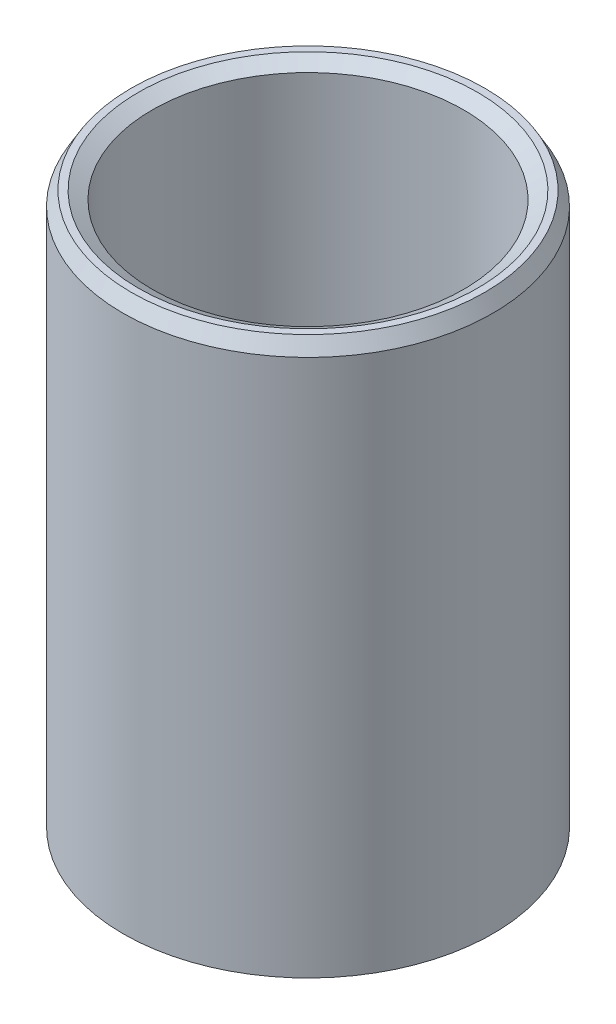
from build123d import *
from OCP.BRepFilletAPI import BRepFilletAPI_MakeChamfer

# Parameters (mm, degrees)
SKETCH1_R           = 22.5
BOSS_EXTRUDE1_DEPTH = 68.083866794
SKETCH2_R           = 18.933896838
CUT_EXTRUDE1_DEPTH  = 76.152597544
CHAMFER1_SIZE       = 1.708524689
CHAMFER1_SIZE2      = 0.986417189


with BuildPart() as part:
    # Sketch1 → Boss-Extrude1 (new body)
    with BuildSketch(Plane(origin=(0, 0, 0), x_dir=(1, 0, 0), z_dir=(0, 1, 0))):
        Circle(SKETCH1_R)
    extrude(amount=BOSS_EXTRUDE1_DEPTH)

    # Sketch2 → Cut-Extrude1 (cut, through all)
    with BuildSketch(Plane(origin=(0, 0, 0), x_dir=(1, 0, 0), z_dir=(0, 1, 0))):
        Circle(SKETCH2_R)
    extrude(amount=CUT_EXTRUDE1_DEPTH, mode=Mode.SUBTRACT)

    # Chamfer1: one chamfer whose edges measure the first distance from different faces: ONE call of the kernel's chamfer builder (chamfer() names one face for all edges)
    chamfer1_edges_1 = [part.edges().sort_by_distance(p)[0] for p in [
        (-18.933896838, 68.083866794, 0),
    ]]
    chamfer1_side_1 = [part.faces().sort_by_distance(p)[0] for p in [
        (-21.863603897, 68.083866794, 0),
    ]]
    chamfer1_edges_2 = [part.edges().sort_by_distance(p)[0] for p in [
        (-18.933896838, 0, 0),
    ]]
    chamfer1_side_2 = [part.faces().sort_by_distance(p)[0] for p in [
        (-18.933896838, 34.041933397, 0),
    ]]
    chamfer1_edges_3 = [part.edges().sort_by_distance(p)[0] for p in [
        (-22.5, 0, 0),
    ]]
    chamfer1_side_3 = [part.faces().sort_by_distance(p)[0] for p in [
        (-21.863603897, 0, 0),
    ]]
    chamfer1_edges_4 = [part.edges().sort_by_distance(p)[0] for p in [
        (-22.5, 68.083866794, 0),
    ]]
    chamfer1_side_4 = [part.faces().sort_by_distance(p)[0] for p in [
        (-22.5, 34.041933397, 0),
    ]]
    chamfer1 = BRepFilletAPI_MakeChamfer(part.part.solid().wrapped)
    for e in chamfer1_edges_1:
        chamfer1.Add(CHAMFER1_SIZE, CHAMFER1_SIZE2, e.wrapped, chamfer1_side_1[0].wrapped)  # the first distance lies on this face
    for e in chamfer1_edges_2:
        chamfer1.Add(CHAMFER1_SIZE, CHAMFER1_SIZE2, e.wrapped, chamfer1_side_2[0].wrapped)  # the first distance lies on this face
    for e in chamfer1_edges_3:
        chamfer1.Add(CHAMFER1_SIZE, CHAMFER1_SIZE2, e.wrapped, chamfer1_side_3[0].wrapped)  # the first distance lies on this face
    for e in chamfer1_edges_4:
        chamfer1.Add(CHAMFER1_SIZE, CHAMFER1_SIZE2, e.wrapped, chamfer1_side_4[0].wrapped)  # the first distance lies on this face
    add(Compound.cast(chamfer1.Shape()), mode=Mode.REPLACE)


solid = part.part
